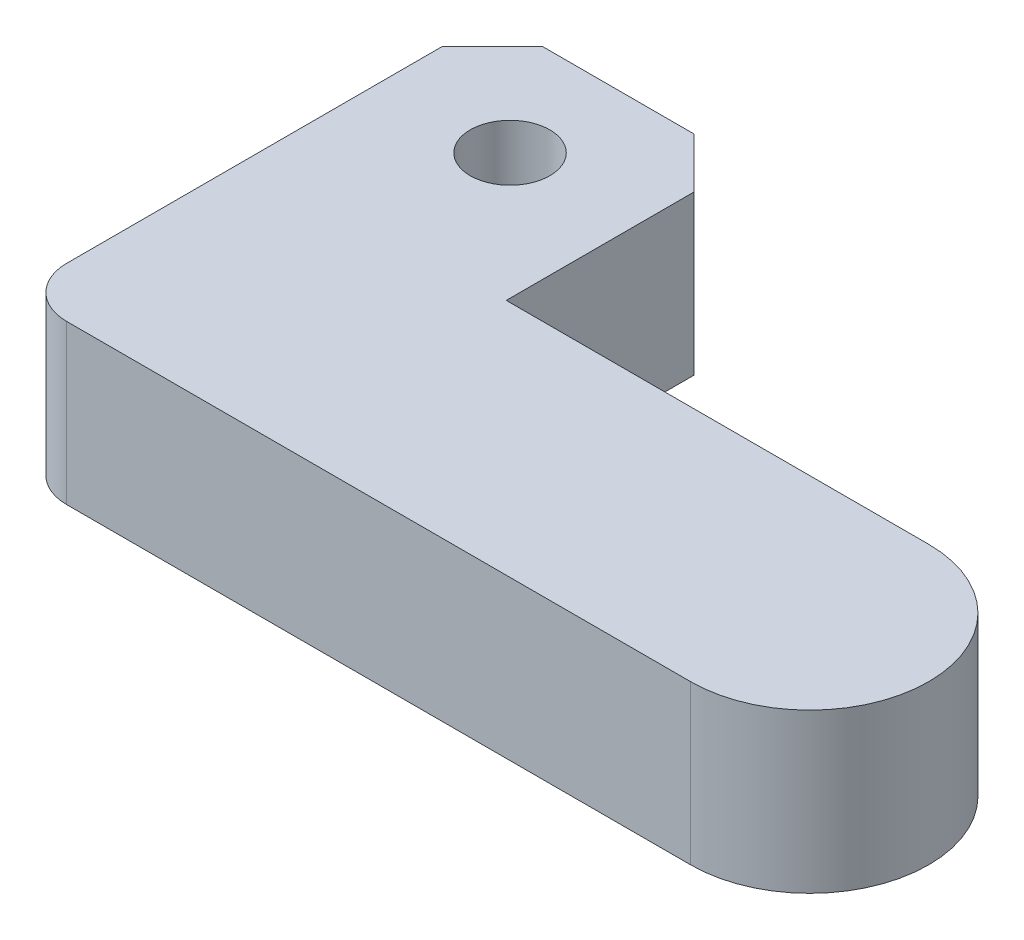
from build123d import *

# Parameters (mm, degrees)
SKETCH1_R           = 2.50825
BOSS_EXTRUDE1_DEPTH = 10
FILLET1_R           = 3.175
CHAMFER1_SIZE       = 3.175


with BuildPart() as part:
    # Sketch1 → Boss-Extrude1 (new body)
    with BuildSketch(Plane(origin=(0, 0, 0), x_dir=(1, 0, 0), z_dir=(0, 1, 0))):
        with BuildLine():
            Line((0, 30), (0, 0))
            Line((0, 0), (42.5, 0))
            ThreePointArc((42.5, 0), (50, 7.5), (42.5, 15))
            Line((42.5, 15), (15.875, 15))
            Line((15.875, 15), (15.875, 30))
            Line((15.875, 30), (0, 30))
        make_face()
        with Locations((7.9375, 23.175)):
            Circle(SKETCH1_R, mode=Mode.SUBTRACT)
    extrude(amount=BOSS_EXTRUDE1_DEPTH)

    # Fillet1
    fillet1_edges = [part.edges().sort_by_distance(p)[0] for p in [
        (0, 5, 0),
    ]]
    fillet(fillet1_edges, radius=FILLET1_R)

    # Chamfer1
    chamfer1_edges = [part.edges().sort_by_distance(p)[0] for p in [
        (0, 5, -30),
        (15.875, 5, -30),
    ]]
    chamfer(chamfer1_edges, length=CHAMFER1_SIZE)


solid = part.part
